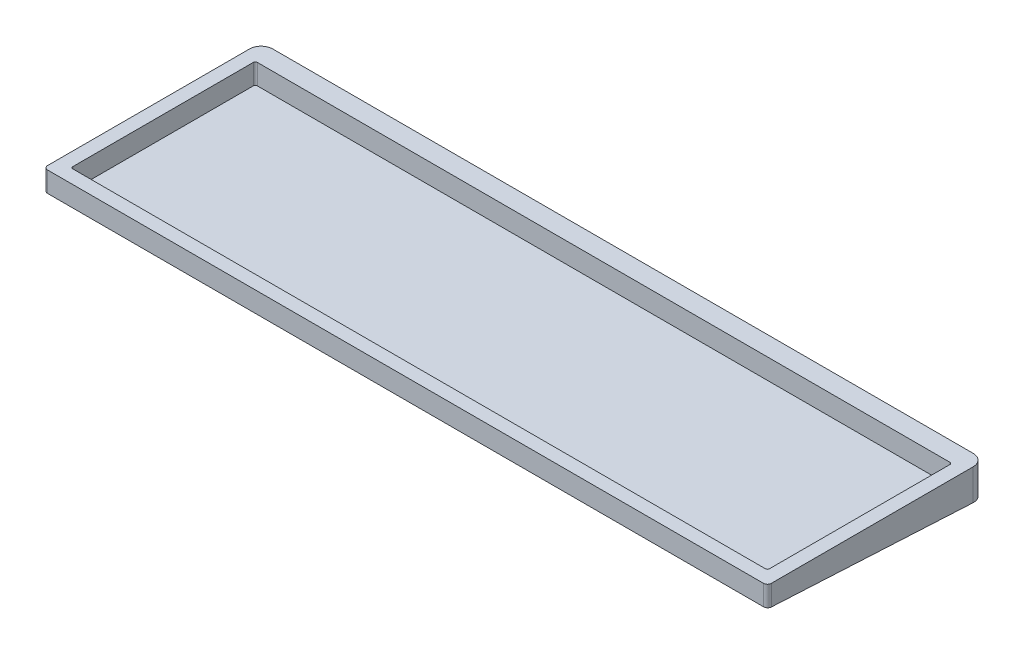
from build123d import *

# Parameters (mm, degrees)
BOSS_EXTRUDE1_DEPTH = 10.5
BOSS_EXTRUDE3_START = 10.5
BOSS_EXTRUDE3_DEPTH = 10.5
CUT_EXTRUDE4_DEPTH  = 400


with BuildPart() as part:
    # Sketch2 → Boss-Extrude1 (new body)
    with BuildSketch(Plane(origin=(0, 0, 0), x_dir=(1, 0, 0), z_dir=(0, 1, 0))):
        with BuildLine():
            Line((180.825, 57.625), (-180.825, 57.625))
            ThreePointArc((-180.825, 57.625), (-185.067640687, 55.867640687), (-186.825, 51.625))
            Line((-186.825, 51.625), (-186.825, -52.625))
            ThreePointArc((-186.825, -52.625), (-186.239213562, -54.039213562), (-184.825, -54.625))
            Line((-184.825, -54.625), (184.825, -54.625))
            ThreePointArc((184.825, -54.625), (186.239213562, -54.039213562), (186.825, -52.625))
            Line((186.825, -52.625), (186.825, 51.625))
            ThreePointArc((186.825, 51.625), (185.067640687, 55.867640687), (180.825, 57.625))
        make_face()
        with BuildLine():
            Line((-179.825, -46.625), (-179.825, 46.625))
            ThreePointArc((-179.825, 46.625), (-179.532106781, 47.332106781), (-178.825, 47.625))
            Line((-178.825, 47.625), (178.825, 47.625))
            ThreePointArc((178.825, 47.625), (179.532106781, 47.332106781), (179.825, 46.625))
            Line((179.825, 46.625), (179.825, -46.625))
            ThreePointArc((179.825, -46.625), (179.532106781, -47.332106781), (178.825, -47.625))
            Line((178.825, -47.625), (-178.825, -47.625))
            ThreePointArc((-178.825, -47.625), (-179.532106781, -47.332106781), (-179.825, -46.625))
        make_face(mode=Mode.SUBTRACT)
    extrude(amount=BOSS_EXTRUDE1_DEPTH)

    # Sketch4 → Boss-Extrude3 (add)
    with BuildSketch(Plane.XZ.offset(BOSS_EXTRUDE3_START)):
        with BuildLine():
            ThreePointArc((180.825, -57.625), (185.067640687, -55.867640687), (186.825, -51.625))
            Line((186.825, -51.625), (186.825, 52.625))
            ThreePointArc((186.825, 52.625), (186.239213562, 54.039213562), (184.825, 54.625))
            Line((184.825, 54.625), (-184.825, 54.625))
            ThreePointArc((-184.825, 54.625), (-186.239213562, 54.039213562), (-186.825, 52.625))
            Line((-186.825, 52.625), (-186.825, -51.625))
            ThreePointArc((-186.825, -51.625), (-185.067640687, -55.867640687), (-180.825, -57.625))
            Line((-180.825, -57.625), (180.825, -57.625))
        make_face()
    extrude(amount=-BOSS_EXTRUDE3_DEPTH)

    # Sketch8 → Cut-Extrude4 (cut)
    with BuildSketch(Plane.ZY.offset(186.825)):
        Polygon((54.625, 0), (-57.625, -5.882773225), (-57.625, -10.5), (54.625, -10.5), align=None)
    extrude(amount=-CUT_EXTRUDE4_DEPTH, mode=Mode.SUBTRACT)


solid = part.part
